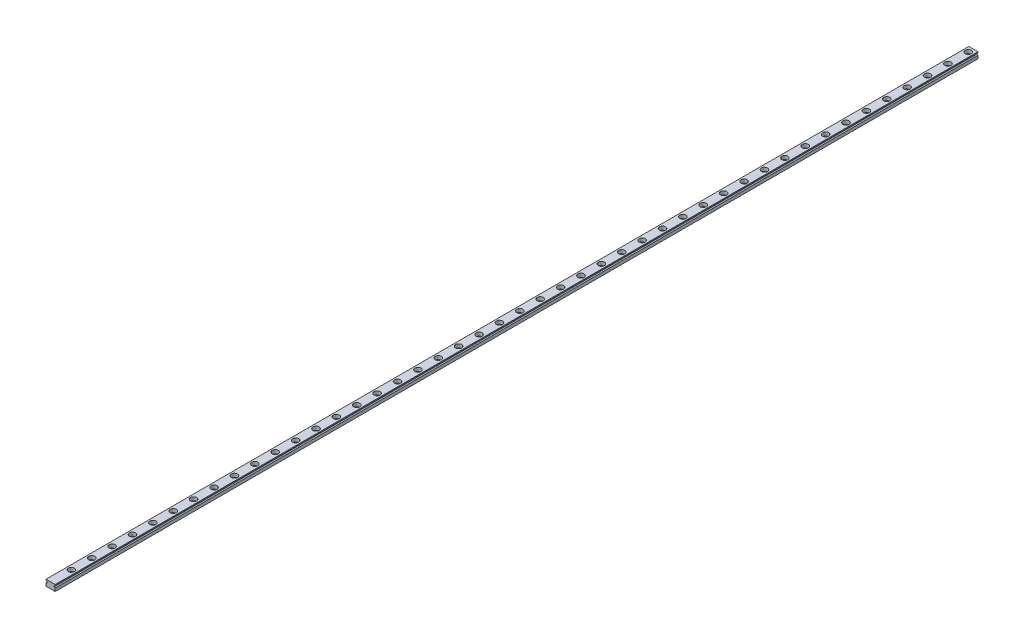
from build123d import *

# Parameters (mm, degrees)
EXTRUDE1_DEPTH  = 905.4
SKETCH2_R       = 3
EXTRUDE2_DEPTH  = 3.5
SKETCH_R        = 1.75
EXTRUDE3_DEPTH  = 906.431063085
LPATTERN1_COUNT = 45
LPATTERN1_PITCH = 20


with BuildPart() as part:
    # Sketch1 → Extrude1 (new body)
    with BuildSketch(Plane.XY):
        with BuildLine():
            Line((-4.5, -3), (4.5, -3))
            Line((4.5, -3), (4.5, 0))
            ThreePointArc((4.5, 0), (3.93077967, 0.177814974), (3.563991137, 0.648023568))
            Line((3.563991137, 0.648023568), (3.235073025, 0.648023568))
            Line((3.235073025, 0.648023568), (3.235073025, 1.351976432))
            Line((3.235073025, 1.351976432), (3.563991137, 1.351976432))
            ThreePointArc((3.563991137, 1.351976432), (3.93077967, 1.822185026), (4.5, 2))
            Line((4.5, 2), (4.5, 3))
            Line((4.5, 3), (-4.5, 3))
            Line((-4.5, 3), (-4.5, 2))
            ThreePointArc((-4.5, 2), (-3.93077967, 1.822185026), (-3.563991137, 1.351976432))
            Line((-3.563991137, 1.351976432), (-3.235073025, 1.351976432))
            Line((-3.235073025, 1.351976432), (-3.235073025, 0.648023568))
            Line((-3.235073025, 0.648023568), (-3.563991137, 0.648023568))
            ThreePointArc((-3.563991137, 0.648023568), (-3.93077967, 0.177814974), (-4.5, 0))
            Line((-4.5, 0), (-4.5, -3))
        make_face()
    extrude(amount=EXTRUDE1_DEPTH)

    # Sketch2 → Extrude2 (cut)
    with BuildSketch(Plane(origin=(0, 3, 0), x_dir=(1, 0, 0), z_dir=(0, 1, 0))):
        with Locations((0, -5)):
            Circle(SKETCH2_R)
    extrude2 = extrude(amount=-EXTRUDE2_DEPTH, mode=Mode.SUBTRACT)

    # Sketch → Extrude3 (cut, through all)
    with BuildSketch(Plane(origin=(0, 3, 0), x_dir=(1, 0, 0), z_dir=(0, 1, 0))):
        with Locations((0, -5)):
            Circle(SKETCH_R)
    extrude3 = extrude(amount=-EXTRUDE3_DEPTH, mode=Mode.SUBTRACT)

    # LPattern1: Extrude2, Extrude3 ×45
    with Locations(*[(0, 0, i * LPATTERN1_PITCH) for i in range(1, LPATTERN1_COUNT)]):
        add(extrude2, mode=Mode.SUBTRACT)
        add(extrude3, mode=Mode.SUBTRACT)


solid = part.part
